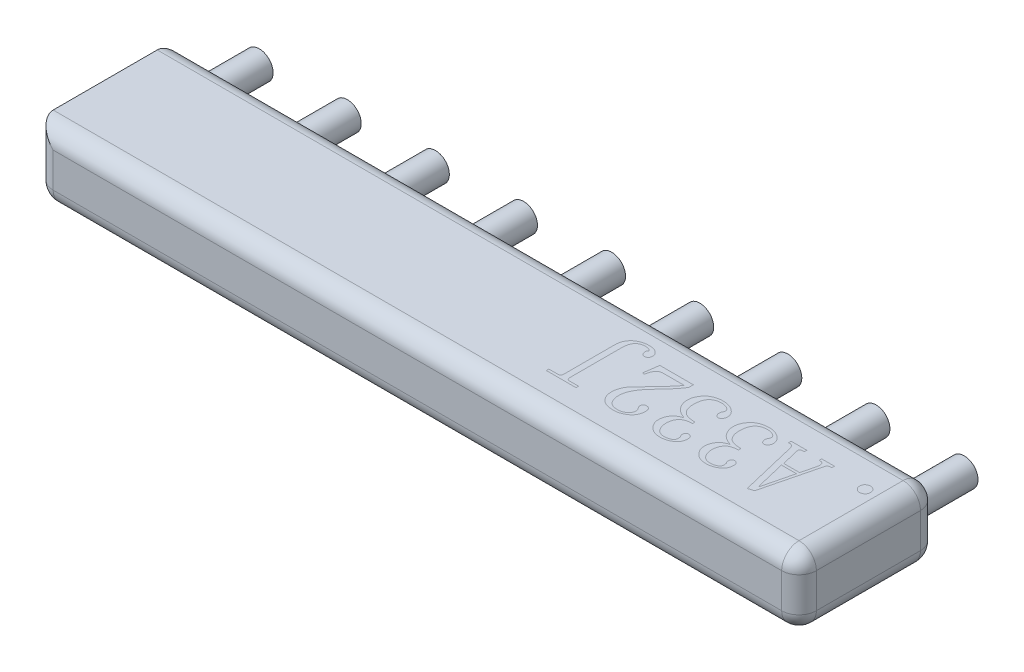
from build123d import *

# Parameters (mm, degrees)
SKETCH_1_W      = 22
SKETCH_1_H      = 2
EXTRUDE_1_DEPTH = 4
FILLET_1_R      = 0.5
SKETCH_2_R      = 0.4
EXTRUDE_2_DEPTH = 1.6


with BuildPart() as part:
    # 草图1 → 凸台-拉伸1 (new body)
    with BuildSketch(Plane.XY):
        with Locations((11, 1)):
            Rectangle(SKETCH_1_W, SKETCH_1_H)
    extrude(amount=EXTRUDE_1_DEPTH)

    # 圆角1
    fillet_1_edges = [part.edges().sort_by_distance(p)[0] for p in [
        (0, 1, 0),
        (0, 1, 4),
        (22, 1, 0),
        (22, 1, 4),
        (22, 2, 2),
        (22, 0, 2),
        (0, 0, 2),
        (11, 0, 0),
        (11, 2, 0),
        (11, 0, 4),
        (11, 2, 4),
    ]]
    fillet(fillet_1_edges, radius=FILLET_1_R)

    # 草图2 → 凸台-拉伸2 (add)
    with BuildSketch(Plane(origin=(0, 0, 0), x_dir=(-1, 0, 0), z_dir=(0, 0, -1))):
        with Locations((-11, 1)):
            Circle(SKETCH_2_R)
        with Locations((-8.46, 1)):
            Circle(SKETCH_2_R)
        with Locations((-5.92, 1)):
            Circle(SKETCH_2_R)
        with Locations((-3.38, 1)):
            Circle(SKETCH_2_R)
        with Locations((-0.84, 1)):
            Circle(SKETCH_2_R)
        with Locations((-13.54, 1)):
            Circle(SKETCH_2_R)
        with Locations((-16.08, 1)):
            Circle(SKETCH_2_R)
        with Locations((-18.62, 1)):
            Circle(SKETCH_2_R)
        with Locations((-21.16, 1)):
            Circle(SKETCH_2_R)
    extrude(amount=EXTRUDE_2_DEPTH)


solid = part.part
